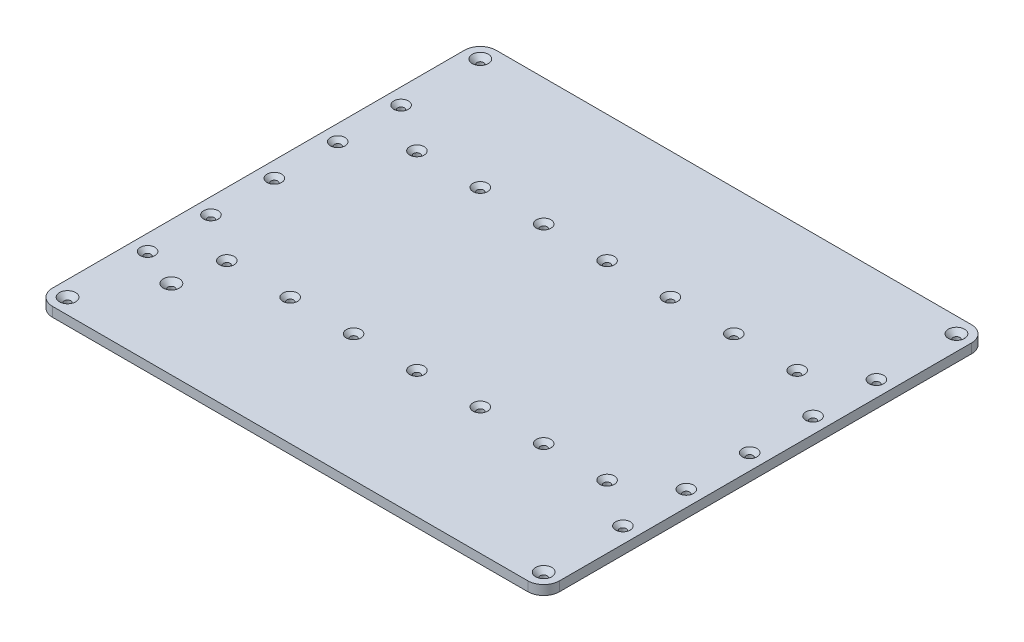
from build123d import *

# Parameters (mm, degrees)
EXTRUDE_1_DEPTH     = 3
SKETCH_5_R          = 2.1
CUT_EXTRUDE_4_DEPTH = 240
CHAMFER_2_SIZE      = 2.5
SKETCH_6_R          = 2.1
CUT_EXTRUDE_5_DEPTH = 10
CHAMFER_3_SIZE      = 3
SKETCH_7_R          = 2.1
CUT_EXTRUDE_6_DEPTH = 10
CHAMFER_4_SIZE      = 3


with BuildPart() as part:
    # 草图1 → 凸台-拉伸1 (new, symmetric)
    with BuildSketch(Plane(origin=(0, 0, 0), x_dir=(1, 0, 0), z_dir=(0, 1, 0))):
        with BuildLine():
            Line((-150, -140), (150, -140))
            ThreePointArc((150, -140), (157.071067812, -137.071067812), (160, -130))
            Line((160, -130), (160, 130))
            ThreePointArc((160, 130), (157.071067812, 137.071067812), (150, 140))
            Line((150, 140), (-150, 140))
            ThreePointArc((-150, 140), (-157.071067812, 137.071067812), (-160, 130))
            Line((-160, 130), (-160, -130))
            ThreePointArc((-160, -130), (-157.071067812, -137.071067812), (-150, -140))
        make_face()
    extrude(amount=EXTRUDE_1_DEPTH, both=True)

    # 草图5 → 切除-拉伸4 (cut)
    with BuildSketch(Plane(origin=(0, 3, 0), x_dir=(1, 0, 0), z_dir=(0, 1, 0))):
        with Locations((0, 60)):
            Circle(SKETCH_5_R)
        with Locations((40, 60)):
            Circle(SKETCH_5_R)
        with Locations((80, 60)):
            Circle(SKETCH_5_R)
        with Locations((120, 60)):
            Circle(SKETCH_5_R)
        with Locations((-120, 60)):
            Circle(SKETCH_5_R)
        with Locations((-80, 60)):
            Circle(SKETCH_5_R)
        with Locations((-40, 60)):
            Circle(SKETCH_5_R)
        with Locations((-40, -60)):
            Circle(SKETCH_5_R)
        with Locations((-80, -60)):
            Circle(SKETCH_5_R)
        with Locations((-120, -60)):
            Circle(SKETCH_5_R)
        with Locations((120, -60)):
            Circle(SKETCH_5_R)
        with Locations((80, -60)):
            Circle(SKETCH_5_R)
        with Locations((40, -60)):
            Circle(SKETCH_5_R)
        with Locations((0, -60)):
            Circle(SKETCH_5_R)
        with Locations((-150, 0)):
            Circle(SKETCH_5_R)
        with Locations((-150, -40)):
            Circle(SKETCH_5_R)
        with Locations((-150, -80)):
            Circle(SKETCH_5_R)
        with Locations((-150, 80)):
            Circle(SKETCH_5_R)
        with Locations((-150, 40)):
            Circle(SKETCH_5_R)
        with Locations((150, 40)):
            Circle(SKETCH_5_R)
        with Locations((150, 80)):
            Circle(SKETCH_5_R)
        with Locations((150, -80)):
            Circle(SKETCH_5_R)
        with Locations((150, -40)):
            Circle(SKETCH_5_R)
        with Locations((150, 0)):
            Circle(SKETCH_5_R)
    extrude(amount=-CUT_EXTRUDE_4_DEPTH, mode=Mode.SUBTRACT)

    # 倒角2
    chamfer_2_edges = [part.edges().sort_by_distance(p)[0] for p in [
        (147.9, 3, 40),
        (147.9, 3, 80),
        (117.9, 3, 60),
        (77.9, 3, 60),
        (37.9, 3, 60),
        (-2.1, 3, 60),
        (-42.1, 3, 60),
        (-82.1, 3, 60),
        (-122.1, 3, 60),
        (-152.1, 3, 80),
        (-152.1, 3, 40),
        (-152.1, 3, 0),
        (-152.1, 3, -40),
        (-152.1, 3, -80),
        (-122.1, 3, -60),
        (-82.1, 3, -60),
        (-42.1, 3, -60),
        (-2.1, 3, -60),
        (37.9, 3, -60),
        (147.9, 3, 0),
        (147.9, 3, -40),
        (77.9, 3, -60),
        (117.9, 3, -60),
        (147.9, 3, -80),
    ]]
    chamfer(chamfer_2_edges, length=CHAMFER_2_SIZE)

    # 草图6 → 切除-拉伸5 (cut)
    with BuildSketch(Plane(origin=(0, 3, 0), x_dir=(1, 0, 0), z_dir=(0, 1, 0))):
        with Locations((-150.25, 130.25)):
            Circle(SKETCH_6_R)
        with Locations((150.25, 130.25)):
            Circle(SKETCH_6_R)
        with Locations((150.25, -130.25)):
            Circle(SKETCH_6_R)
        with Locations((-150.25, -130.25)):
            Circle(SKETCH_6_R)
    extrude(amount=-CUT_EXTRUDE_5_DEPTH, mode=Mode.SUBTRACT)

    # 倒角3
    chamfer_3_edges = [part.edges().sort_by_distance(p)[0] for p in [
        (148.15, 3, 130.25),
        (148.15, 3, -130.25),
        (-152.35, 3, -130.25),
        (-152.35, 3, 130.25),
    ]]
    chamfer(chamfer_3_edges, length=CHAMFER_3_SIZE)

    # 草图7 → 切除-拉伸6 (cut)
    with BuildSketch(Plane(origin=(0, -3, 0), x_dir=(-1, 0, 0), z_dir=(0, -1, 0))):
        with Locations((125, -90)):
            Circle(SKETCH_7_R)
    extrude(amount=-CUT_EXTRUDE_6_DEPTH, mode=Mode.SUBTRACT)

    # 倒角4
    chamfer_4_edges = [part.edges().sort_by_distance(p)[0] for p in [
        (-122.9, 3, 90),
    ]]
    chamfer(chamfer_4_edges, length=CHAMFER_4_SIZE)


solid = part.part
